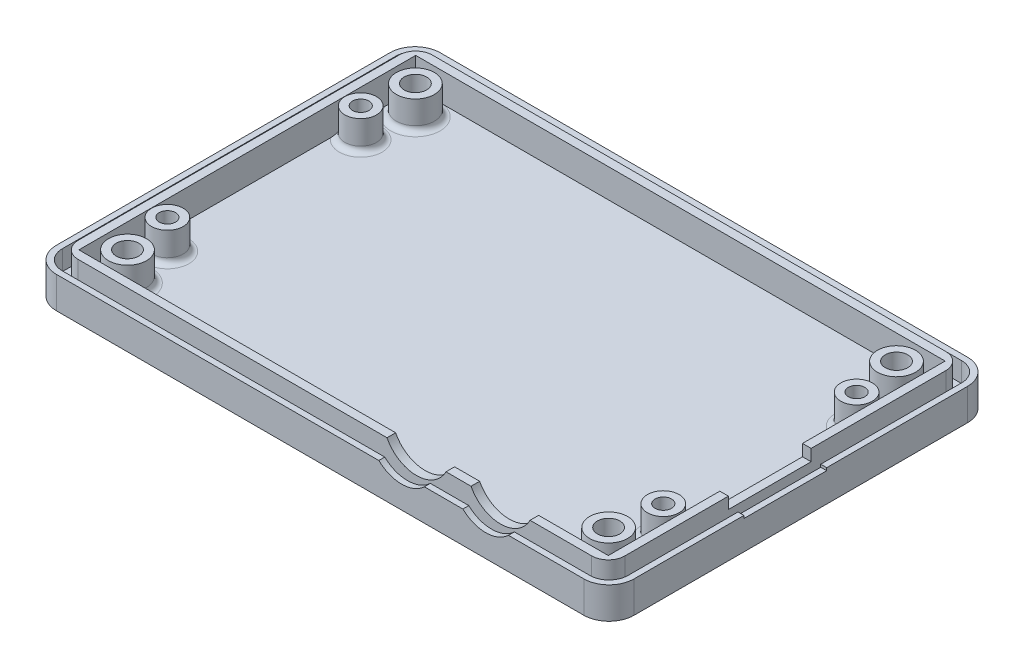
from build123d import *

# Parameters (mm, degrees)
SKETCH1_W           = 87.3
SKETCH1_H           = 58
BOSS_EXTRUDE1_DEPTH = 1.77
FILLET1_R           = 3.8
BOSS_EXTRUDE2_START = 3
BOSS_EXTRUDE2_DEPTH = 3
SKETCH3_W           = 82.6
SKETCH3_H           = 53.5
SKETCH3_W_2         = 80
SKETCH3_H_2         = 50.9
BOSS_EXTRUDE3_DEPTH = 4.35
FILLET2_R           = 2.5
SKETCH4_R           = 2.875
BOSS_EXTRUDE4_DEPTH = 4.35
SKETCH5_R           = 1.7
CUT_EXTRUDE1_DEPTH  = 6.22
CHAMFER1_SIZE       = 1.45
SKETCH6_R           = 2.39
SKETCH6_R_2         = 1.24
BOSS_EXTRUDE5_DEPTH = 4.45
FILLET3_R           = 0.85
SKETCH7_R           = 5.01
CUT_EXTRUDE2_DEPTH  = 4.45
CUT_EXTRUDE3_REACH  = 95.529
SKETCH8_W           = 7.6
SKETCH8_H           = 1.35
SKETCH8_H_2         = 0.4
SKETCH8_W_2         = 1
SKETCH8_W_3         = 3.9


with BuildPart() as part:
    # Sketch1 → Boss-Extrude1 (new body)
    with BuildSketch(Plane(origin=(0, 0, 0), x_dir=(1, 0, 0), z_dir=(0, 1, 0))):
        with Locations((4.931251627, 3.980600764)):
            Rectangle(SKETCH1_W, SKETCH1_H)
    extrude(amount=BOSS_EXTRUDE1_DEPTH)

    # Fillet1
    fillet1_edges = [part.edges().sort_by_distance(p)[0] for p in [
        (-38.718748373, 0.885, -32.980600764),
        (48.581251627, 0.885, -32.980600764),
        (48.581251627, 0.885, 25.019399236),
        (-38.718748373, 0.885, 25.019399236),
    ]]
    fillet(fillet1_edges, radius=FILLET1_R)

    # Sketch2 → Boss-Extrude2 (add)
    with BuildSketch(Plane(origin=(0, 1.77, 0), x_dir=(1, 0, 0), z_dir=(0, 1, 0)).offset(BOSS_EXTRUDE2_START)):
        with BuildLine():
            Line((44.781251627, 32.980600764), (-34.918748373, 32.980600764))
            ThreePointArc((-34.918748373, 32.980600764), (-37.605754141, 31.867606533), (-38.718748373, 29.180600764))
            Line((-38.718748373, 29.180600764), (-38.718748373, -21.219399236))
            ThreePointArc((-38.718748373, -21.219399236), (-37.605754141, -23.906405004), (-34.918748373, -25.019399236))
            Line((-34.918748373, -25.019399236), (44.781251627, -25.019399236))
            ThreePointArc((44.781251627, -25.019399236), (47.468257396, -23.906405004), (48.581251627, -21.219399236))
            Line((48.581251627, -21.219399236), (48.581251627, 29.180600764))
            ThreePointArc((48.581251627, 29.180600764), (47.468257396, 31.867606533), (44.781251627, 32.980600764))
        make_face()
        with BuildLine():
            Line((47.681251627, -21.219399236), (47.681251627, 29.180600764))
            ThreePointArc((47.681251627, 29.180600764), (46.831861293, 31.231210429), (44.781251627, 32.080600764))
            Line((44.781251627, 32.080600764), (-34.918748373, 32.080600764))
            ThreePointArc((-34.918748373, 32.080600764), (-36.969358038, 31.231210429), (-37.818748373, 29.180600764))
            Line((-37.818748373, 29.180600764), (-37.818748373, -21.219399236))
            ThreePointArc((-37.818748373, -21.219399236), (-36.969358038, -23.270008901), (-34.918748373, -24.119399236))
            Line((-34.918748373, -24.119399236), (44.781251627, -24.119399236))
            ThreePointArc((44.781251627, -24.119399236), (46.831861293, -23.270008901), (47.681251627, -21.219399236))
        make_face(mode=Mode.SUBTRACT)
    extrude(amount=-BOSS_EXTRUDE2_DEPTH)

    # Sketch3 → Boss-Extrude3 (add)
    with BuildSketch(Plane(origin=(0, 1.77, 0), x_dir=(1, 0, 0), z_dir=(0, 1, 0))):
        with Locations((4.931251627, 3.980600764)):
            Rectangle(SKETCH3_W, SKETCH3_H)
        with Locations((4.931251627, 3.980600764)):
            Rectangle(SKETCH3_W_2, SKETCH3_H_2, mode=Mode.SUBTRACT)
    extrude(amount=BOSS_EXTRUDE3_DEPTH)

    # Fillet2
    fillet2_edges = [part.edges().sort_by_distance(p)[0] for p in [
        (-36.368748373, 3.945, -30.730600764),
        (-36.368748373, 3.945, 22.769399236),
        (46.231251627, 3.945, 22.769399236),
        (46.231251627, 3.945, -30.730600764),
    ]]
    fillet(fillet2_edges, radius=FILLET2_R)

    # Sketch4 → Boss-Extrude4 (add)
    with BuildSketch(Plane(origin=(0, 1.77, 0), x_dir=(1, 0, 0), z_dir=(0, 1, 0))):
        with Locations(Location((-31.418748373, -17.769399236, 0), (0, 0, 270))):
            Circle(SKETCH4_R)
        with Locations(Location((41.281251627, -17.769399236, 0), (0, 0, 270))):
            Circle(SKETCH4_R)
        with Locations(Location((41.281251627, 25.730600764, 0), (0, 0, 270))):
            Circle(SKETCH4_R)
        with Locations(Location((-31.418748373, 25.730600764, 0), (0, 0, 270))):
            Circle(SKETCH4_R)
    extrude(amount=BOSS_EXTRUDE4_DEPTH)

    # Sketch5 → Cut-Extrude1 (cut)
    with BuildSketch(Plane(origin=(0, 6.12, 0), x_dir=(1, 0, 0), z_dir=(0, 1, 0))):
        with Locations(Location((-31.418748373, 25.730600764, 0), (0, 0, 270))):
            Circle(SKETCH5_R)
        with Locations(Location((41.281251627, 25.730600764, 0), (0, 0, 270))):
            Circle(SKETCH5_R)
        with Locations(Location((-31.418748373, -17.769399236, 0), (0, 0, 270))):
            Circle(SKETCH5_R)
        with Locations(Location((41.281251627, -17.769399236, 0), (0, 0, 270))):
            Circle(SKETCH5_R)
    extrude(amount=-CUT_EXTRUDE1_DEPTH, mode=Mode.SUBTRACT)

    # Chamfer1
    chamfer1_edges = [part.edges().sort_by_distance(p)[0] for p in [
        (-31.418748373, 0, -27.430600764),
        (41.281251627, 0, -27.430600764),
        (-31.418748373, 0, 16.069399236),
        (41.281251627, 0, 16.069399236),
    ]]
    chamfer(chamfer1_edges, length=CHAMFER1_SIZE)

    # Sketch6 → Boss-Extrude5 (add)
    # profile 1 of 4: a face of its own
    with BuildSketch(Plane(origin=(0, 1.77, 0), x_dir=(1, 0, 0), z_dir=(0, 1, 0))):
        with Locations(Location((-32.533748373, -10.624399236, 0), (0, 0, 270))):
            Circle(SKETCH6_R)
        with Locations(Location((-32.533748373, -10.624399236, 0), (0, 0, 270))):
            Circle(SKETCH6_R_2, mode=Mode.SUBTRACT)
    # profile 2 of 4: a face of its own
    with BuildSketch(Plane(origin=(0, 1.77, 0), x_dir=(1, 0, 0), z_dir=(0, 1, 0))):
        with Locations(Location((42.396251627, -10.624399236, 0), (0, 0, 270))):
            Circle(SKETCH6_R)
        with Locations(Location((42.396251627, -10.624399236, 0), (0, 0, 270))):
            Circle(SKETCH6_R_2, mode=Mode.SUBTRACT)
    # profile 3 of 4: a face of its own
    with BuildSketch(Plane(origin=(0, 1.77, 0), x_dir=(1, 0, 0), z_dir=(0, 1, 0))):
        with Locations(Location((42.396251627, 18.585600764, 0), (0, 0, 270))):
            Circle(SKETCH6_R)
        with Locations(Location((42.396251627, 18.585600764, 0), (0, 0, 270))):
            Circle(SKETCH6_R_2, mode=Mode.SUBTRACT)
    # profile 4 of 4: a face of its own
    with BuildSketch(Plane(origin=(0, 1.77, 0), x_dir=(1, 0, 0), z_dir=(0, 1, 0))):
        with Locations(Location((-32.533748373, 18.585600764, 0), (0, 0, 270))):
            Circle(SKETCH6_R)
        with Locations(Location((-32.533748373, 18.585600764, 0), (0, 0, 270))):
            Circle(SKETCH6_R_2, mode=Mode.SUBTRACT)
    extrude(amount=BOSS_EXTRUDE5_DEPTH)

    # Fillet3
    # the kernel refuses this fillet: 0.85 mm, written as the material it adds along each edge
    with BuildSketch(Plane(origin=(-31.418748373, 1.77, 17.769399236), x_dir=(0, 0, 1), z_dir=(-1, 0, 0))) as fillet3_piece_1:
        with BuildLine():
            CenterArc((2.875 + FILLET3_R, FILLET3_R), FILLET3_R, 180, 90)
            Line((2.875 + FILLET3_R, 0), (2.875, 0))
            Line((2.875, 0), (2.875, FILLET3_R))
        make_face()
    revolve(axis=Axis((-31.418748373, 1.77, 17.769399236), (0, 1, 0)))
    with BuildSketch(Plane(origin=(41.281251627, 1.77, 17.769399236), x_dir=(0, 0, 1), z_dir=(-1, 0, 0))) as fillet3_piece_2:
        with BuildLine():
            CenterArc((2.875 + FILLET3_R, FILLET3_R), FILLET3_R, 180, 90)
            Line((2.875 + FILLET3_R, 0), (2.875, 0))
            Line((2.875, 0), (2.875, FILLET3_R))
        make_face()
    revolve(axis=Axis((41.281251627, 1.77, 17.769399236), (0, 1, 0)))
    with BuildSketch(Plane(origin=(41.281251627, 1.77, -25.730600764), x_dir=(0, 0, 1), z_dir=(-1, 0, 0))) as fillet3_piece_3:
        with BuildLine():
            CenterArc((2.875 + FILLET3_R, FILLET3_R), FILLET3_R, 180, 90)
            Line((2.875 + FILLET3_R, 0), (2.875, 0))
            Line((2.875, 0), (2.875, FILLET3_R))
        make_face()
    revolve(axis=Axis((41.281251627, 1.77, -25.730600764), (0, 1, 0)))
    with BuildSketch(Plane(origin=(-31.418748373, 1.77, -25.730600764), x_dir=(0, 0, 1), z_dir=(-1, 0, 0))) as fillet3_piece_4:
        with BuildLine():
            CenterArc((2.875 + FILLET3_R, FILLET3_R), FILLET3_R, 180, 90)
            Line((2.875 + FILLET3_R, 0), (2.875, 0))
            Line((2.875, 0), (2.875, FILLET3_R))
        make_face()
    revolve(axis=Axis((-31.418748373, 1.77, -25.730600764), (0, 1, 0)))
    with BuildSketch(Plane(origin=(-32.533748373, 1.77, -18.585600764), x_dir=(0, 0, 1), z_dir=(-1, 0, 0))) as fillet3_piece_5:
        with BuildLine():
            CenterArc((2.39 + FILLET3_R, FILLET3_R), FILLET3_R, 180, 90)
            Line((2.39, FILLET3_R), (2.39, 0))
            Line((2.39, 0), (2.39 + FILLET3_R, 0))
        make_face()
    revolve(axis=Axis((-32.533748373, 1.77, -18.585600764), (0, 1, 0)))
    with BuildSketch(Plane(origin=(-32.533748373, 1.77, 10.624399236), x_dir=(0, 0, 1), z_dir=(-1, 0, 0))) as fillet3_piece_6:
        with BuildLine():
            CenterArc((2.39 + FILLET3_R, FILLET3_R), FILLET3_R, 180, 90)
            Line((2.39, FILLET3_R), (2.39, 0))
            Line((2.39, 0), (2.39 + FILLET3_R, 0))
        make_face()
    revolve(axis=Axis((-32.533748373, 1.77, 10.624399236), (0, 1, 0)))
    with BuildSketch(Plane(origin=(42.396251627, 1.77, -18.585600764), x_dir=(0, 0, 1), z_dir=(-1, 0, 0))) as fillet3_piece_7:
        with BuildLine():
            CenterArc((2.39 + FILLET3_R, FILLET3_R), FILLET3_R, 180, 90)
            Line((2.39, FILLET3_R), (2.39, 0))
            Line((2.39, 0), (2.39 + FILLET3_R, 0))
        make_face()
    revolve(axis=Axis((42.396251627, 1.77, -18.585600764), (0, 1, 0)))
    with BuildSketch(Plane(origin=(42.396251627, 1.77, 10.624399236), x_dir=(0, 0, 1), z_dir=(-1, 0, 0))) as fillet3_piece_8:
        with BuildLine():
            CenterArc((2.39 + FILLET3_R, FILLET3_R), FILLET3_R, 180, 90)
            Line((2.39, FILLET3_R), (2.39, 0))
            Line((2.39, 0), (2.39 + FILLET3_R, 0))
        make_face()
    revolve(axis=Axis((42.396251627, 1.77, 10.624399236), (0, 1, 0)))

    # Sketch7 → Cut-Extrude2 (cut)
    with BuildSketch(Plane.XY.offset(25.019399236)):
        with Locations((29.950251627, 8.4075)):
            Circle(SKETCH7_R)
        with Locations((17.250251627, 8.4075)):
            Circle(SKETCH7_R)
    extrude(amount=-CUT_EXTRUDE2_DEPTH, mode=Mode.SUBTRACT)

    # Cut-Extrude3: up to this face of the body (flat: up to its plane)
    cut_extrude3_end = Plane(part.part.faces().sort_by_distance((44.931251627, 3.958465336, -3.980596929))[0])
    # Sketch8 → Cut-Extrude3 (cut, up to the picked face)
    with BuildSketch(Plane(origin=(48.581251627, 0, 0), x_dir=(0, 0, -1), z_dir=(1, 0, 0)), mode=Mode.PRIVATE) as cut_extrude3_sk1:
        with Locations((-0.819399236, 5.445)):
            Rectangle(SKETCH8_W, SKETCH8_H)
    cut_extrude3_tool1 = split(extrude(cut_extrude3_sk1.sketch, amount=-CUT_EXTRUDE3_REACH, mode=Mode.PRIVATE), bisect_by=cut_extrude3_end, keep=Keep.BOTH, mode=Mode.PRIVATE)
    # Sketch8 → Cut-Extrude3 (cut, up to the picked face)
    with BuildSketch(Plane(origin=(48.581251627, 0, 0), x_dir=(0, 0, -1), z_dir=(1, 0, 0)), mode=Mode.PRIVATE) as cut_extrude3_sk2:
        with Locations((-0.819399236, 4.57)):
            Rectangle(SKETCH8_W, SKETCH8_H_2)
    cut_extrude3_tool2 = split(extrude(cut_extrude3_sk2.sketch, amount=-CUT_EXTRUDE3_REACH, mode=Mode.PRIVATE), bisect_by=cut_extrude3_end, keep=Keep.BOTH, mode=Mode.PRIVATE)
    # Sketch8 → Cut-Extrude3 (cut, up to the picked face)
    with BuildSketch(Plane(origin=(48.581251627, 0, 0), x_dir=(0, 0, -1), z_dir=(1, 0, 0)), mode=Mode.PRIVATE) as cut_extrude3_sk3:
        with Locations((3.480600764, 4.57)):
            Rectangle(SKETCH8_W_2, SKETCH8_H_2)
    cut_extrude3_tool3 = split(extrude(cut_extrude3_sk3.sketch, amount=-CUT_EXTRUDE3_REACH, mode=Mode.PRIVATE), bisect_by=cut_extrude3_end, keep=Keep.BOTH, mode=Mode.PRIVATE)
    # Sketch8 → Cut-Extrude3 (cut, up to the picked face)
    with BuildSketch(Plane(origin=(48.581251627, 0, 0), x_dir=(0, 0, -1), z_dir=(1, 0, 0)), mode=Mode.PRIVATE) as cut_extrude3_sk4:
        with Locations((3.480600764, 5.445)):
            Rectangle(SKETCH8_W_2, SKETCH8_H)
    cut_extrude3_tool4 = split(extrude(cut_extrude3_sk4.sketch, amount=-CUT_EXTRUDE3_REACH, mode=Mode.PRIVATE), bisect_by=cut_extrude3_end, keep=Keep.BOTH, mode=Mode.PRIVATE)
    # Sketch8 → Cut-Extrude3 (cut, up to the picked face)
    with BuildSketch(Plane(origin=(48.581251627, 0, 0), x_dir=(0, 0, -1), z_dir=(1, 0, 0)), mode=Mode.PRIVATE) as cut_extrude3_sk5:
        with Locations((5.930600764, 5.445)):
            Rectangle(SKETCH8_W_3, SKETCH8_H)
    cut_extrude3_tool5 = split(extrude(cut_extrude3_sk5.sketch, amount=-CUT_EXTRUDE3_REACH, mode=Mode.PRIVATE), bisect_by=cut_extrude3_end, keep=Keep.BOTH, mode=Mode.PRIVATE)
    # Sketch8 → Cut-Extrude3 (cut, up to the picked face)
    with BuildSketch(Plane(origin=(48.581251627, 0, 0), x_dir=(0, 0, -1), z_dir=(1, 0, 0)), mode=Mode.PRIVATE) as cut_extrude3_sk6:
        with Locations((5.930600764, 4.57)):
            Rectangle(SKETCH8_W_3, SKETCH8_H_2)
    cut_extrude3_tool6 = split(extrude(cut_extrude3_sk6.sketch, amount=-CUT_EXTRUDE3_REACH, mode=Mode.PRIVATE), bisect_by=cut_extrude3_end, keep=Keep.BOTH, mode=Mode.PRIVATE)
    add(cut_extrude3_tool1.solids().sort_by(Axis((48.581252, 5.445, 0.819399), (-1, 0, 0)))[0], mode=Mode.SUBTRACT)
    add(cut_extrude3_tool2.solids().sort_by(Axis((48.581252, 4.57, 0.819399), (-1, 0, 0)))[0], mode=Mode.SUBTRACT)
    add(cut_extrude3_tool3.solids().sort_by(Axis((48.581252, 4.57, -3.480601), (-1, 0, 0)))[0], mode=Mode.SUBTRACT)
    add(cut_extrude3_tool4.solids().sort_by(Axis((48.581252, 5.445, -3.480601), (-1, 0, 0)))[0], mode=Mode.SUBTRACT)
    add(cut_extrude3_tool5.solids().sort_by(Axis((48.581252, 5.445, -5.930601), (-1, 0, 0)))[0], mode=Mode.SUBTRACT)
    add(cut_extrude3_tool6.solids().sort_by(Axis((48.581252, 4.57, -5.930601), (-1, 0, 0)))[0], mode=Mode.SUBTRACT)


solid = part.part
